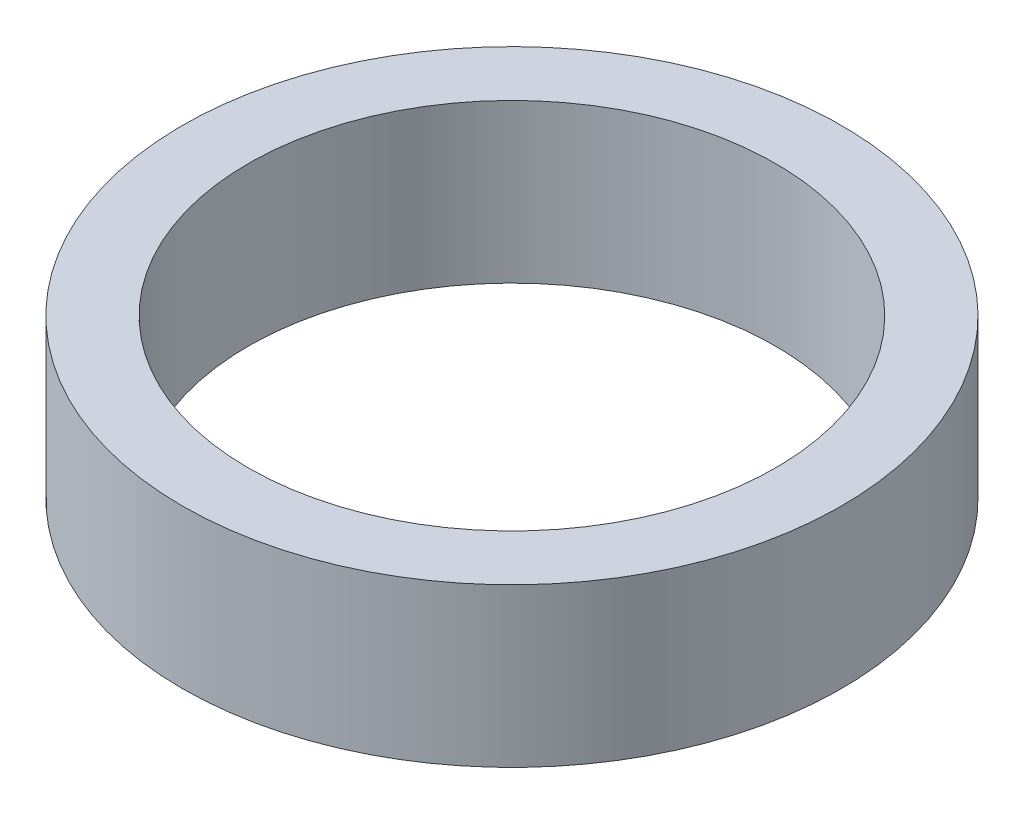
from build123d import *

# Parameters (mm, degrees)
SKETCH1_R           = 62.5
BOSS_EXTRUDE1_DEPTH = 30
SKETCH2_R           = 50
CUT_EXTRUDE1_DEPTH  = 94.340773513


with BuildPart() as part:
    # Sketch1 → Boss-Extrude1 (new body)
    with BuildSketch(Plane(origin=(0, 0, 0), x_dir=(1, 0, 0), z_dir=(0, 1, 0))):
        Circle(SKETCH1_R)
    extrude(amount=BOSS_EXTRUDE1_DEPTH)

    # Sketch2 → Cut-Extrude1 (cut, through all)
    with BuildSketch(Plane(origin=(0, 0, 0), x_dir=(1, 0, 0), z_dir=(0, 1, 0))):
        Circle(SKETCH2_R)
    extrude(amount=CUT_EXTRUDE1_DEPTH, mode=Mode.SUBTRACT)


solid = part.part
